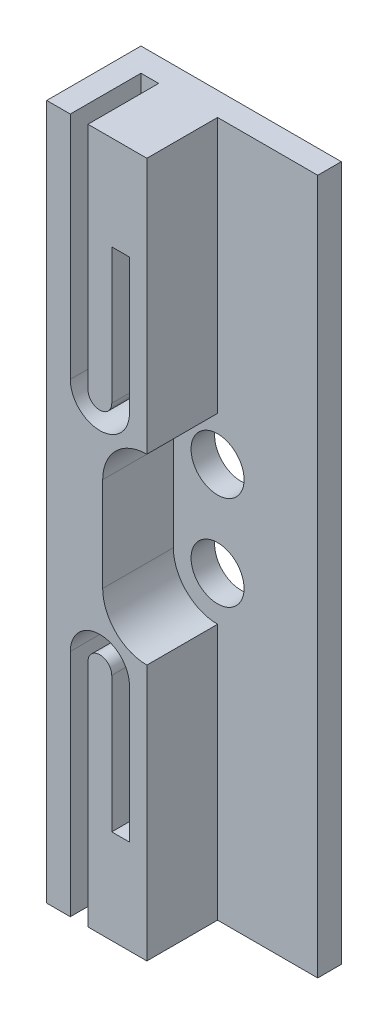
from build123d import *

# Parameters (mm, degrees)
ESQUISSE1_W             = 17
ESQUISSE1_H             = 59
BOSS_EXTRU_1_DEPTH      = 2
ESQUISSE2_W             = 8.5
ESQUISSE2_H             = 59
BOSS_EXTRU_2_DEPTH      = 6
ENL_V_MAT_EXTRU_1_DEPTH = 6
ESQUISSE4_R             = 2.25
ENL_V_MAT_EXTRU_2_DEPTH = 14
ENL_V_MAT_EXTRU_3_DEPTH = 6


with BuildPart() as part:
    # Esquisse1 → Boss.-Extru.1 (new body)
    with BuildSketch(Plane.XY):
        with Locations((8.5, -29.5)):
            Rectangle(ESQUISSE1_W, ESQUISSE1_H)
    extrude(amount=BOSS_EXTRU_1_DEPTH)

    # Esquisse2 → Boss.-Extru.2 (add)
    with BuildSketch(Plane.XY.offset(2)):
        with Locations((4.25, -29.5)):
            Rectangle(ESQUISSE2_W, ESQUISSE2_H)
    extrude(amount=BOSS_EXTRU_2_DEPTH)

    # Esquisse3 → Enlèv. mat.-Extru.1 (cut)
    with BuildSketch(Plane.XY.offset(8)):
        with BuildLine():
            Line((2, -39.5), (2, -59))
            Line((2, -59), (3.5, -59))
            Line((3.5, -59), (3.5, -39.5))
            ThreePointArc((3.5, -39.5), (4.509962751, -38.490037249), (5.519925502, -39.5))
            Line((5.519925502, -39.5), (5.519925502, -51))
            Line((5.519925502, -51), (7.019925502, -51))
            Line((7.019925502, -51), (7.019925502, -39.5))
            ThreePointArc((7.019925502, -39.5), (4.509962751, -36.990037249), (2, -39.5))
        make_face()
        with BuildLine():
            Line((2, 0), (2, -19.5))
            ThreePointArc((2, -19.5), (4.509962751, -22.009962751), (7.019925502, -19.5))
            Line((7.019925502, -19.5), (7.019925502, -8))
            Line((7.019925502, -8), (5.519925502, -8))
            Line((5.519925502, -8), (5.519925502, -19.5))
            ThreePointArc((5.519925502, -19.5), (4.509962751, -20.509962751), (3.5, -19.5))
            Line((3.5, -19.5), (3.5, 0))
            Line((3.5, 0), (2, 0))
        make_face()
    extrude(amount=-ENL_V_MAT_EXTRU_1_DEPTH, mode=Mode.SUBTRACT)

    # Esquisse4 → Enlèv. mat.-Extru.2 (cut)
    with BuildSketch(Plane.XY.offset(8)):
        with Locations((8.5, -33.5)):
            Circle(ESQUISSE4_R)
        with Locations((8.5, -25.5)):
            Circle(ESQUISSE4_R)
    extrude(amount=-ENL_V_MAT_EXTRU_2_DEPTH, mode=Mode.SUBTRACT)

    # Esquisse5 → Enlèv. mat.-Extru.3 (cut)
    with BuildSketch(Plane.XY.offset(8)):
        with BuildLine():
            Line((4.75, -25.5), (4.75, -33.5))
            ThreePointArc((4.75, -33.5), (5.848349571, -36.151650429), (8.5, -37.25))
            Line((8.5, -37.25), (8.5, -35.75))
            ThreePointArc((8.5, -35.75), (6.25, -33.5), (8.5, -31.25))
            Line((8.5, -31.25), (8.5, -27.75))
            ThreePointArc((8.5, -27.75), (6.25, -25.5), (8.5, -23.25))
            Line((8.5, -23.25), (8.5, -21.75))
            ThreePointArc((8.5, -21.75), (5.848349571, -22.848349571), (4.75, -25.5))
        make_face()
    extrude(amount=-ENL_V_MAT_EXTRU_3_DEPTH, mode=Mode.SUBTRACT)


solid = part.part
